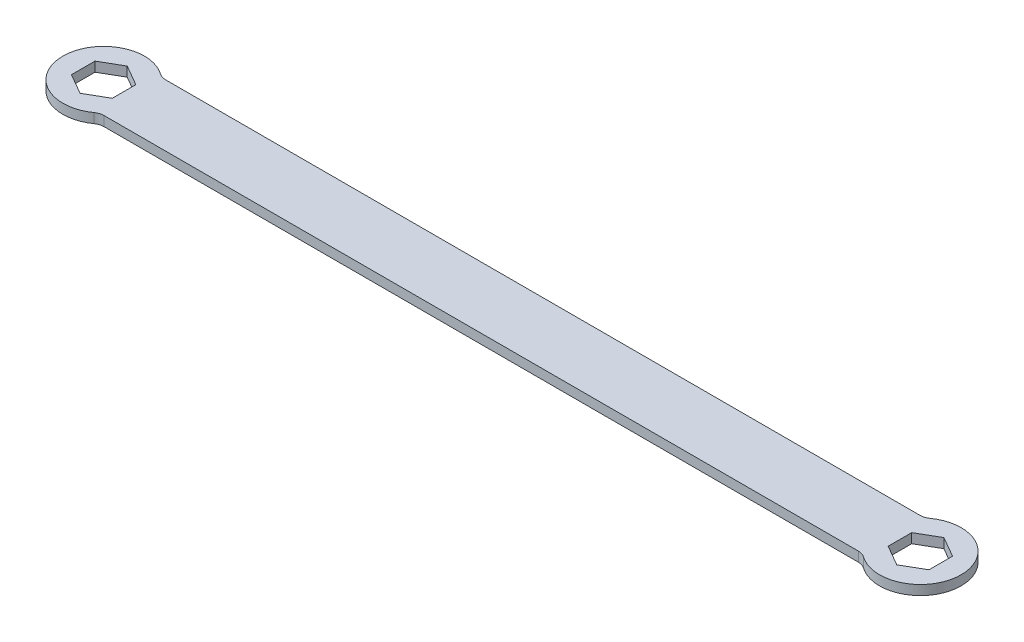
from build123d import *

# Parameters (mm, degrees)
BOSS_EXTRUDE1_DEPTH = 0.75
FILLET1_R           = 2


with BuildPart() as part:
    # Sketch1 → Boss-Extrude1 (new, symmetric)
    with BuildSketch(Plane(origin=(0, 0, 0), x_dir=(1, 0, 0), z_dir=(0, 1, 0))):
        with BuildLine():
            Line((59.35, 4.8), (-59.35, 4.8))
            ThreePointArc((-59.35, 4.8), (-69.857222631, 0), (-59.35, -4.8))
            Line((-59.35, -4.8), (59.35, -4.8))
            ThreePointArc((59.35, -4.8), (69.857222631, 0), (59.35, 4.8))
        make_face()
        Polygon((-60.332222631, 1.833087105), (-60.332222631, -1.833087105), (-63.507222631, -3.666174209), (-66.682222631, -1.833087105), (-66.682222631, 1.833087105), (-63.507222631, 3.666174209), align=None, mode=Mode.SUBTRACT)
        Polygon((63.507222631, -3.666174209), (60.332222631, -1.833087105), (60.332222631, 1.833087105), (63.507222631, 3.666174209), (66.682222631, 1.833087105), (66.682222631, -1.833087105), align=None, mode=Mode.SUBTRACT)
    extrude(amount=BOSS_EXTRUDE1_DEPTH, both=True)

    # Fillet1
    fillet1_edges = [part.edges().sort_by_distance(p)[0] for p in [
        (-59.35, 0, 4.8),
        (-59.35, 0, -4.8),
        (59.35, 0, -4.8),
        (59.35, 0, 4.8),
    ]]
    fillet(fillet1_edges, radius=FILLET1_R)


solid = part.part
